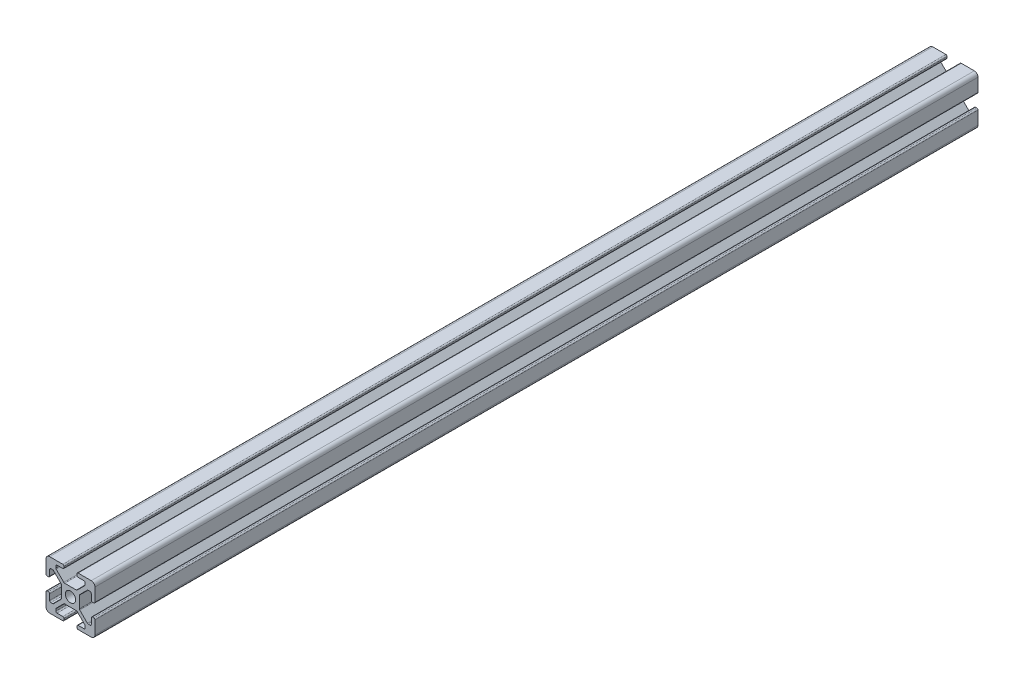
from build123d import *

# Parameters (mm, degrees)
SKETCH1_W               = 20
SKETCH1_H               = 20
BOSS_EXTRUDE1_DEPTH     = 361
CUT_EXTRUDE1_DEPTH      = 362.276902112
FILLET1_R               = 0.5
CIRPATTERN1_START       = -361
CIRPATTERN1_DEPTH       = 361
FILLET2_R               = 1.5
SKETCH3_R               = 2.095
CUT_EXTRUDE2_DEPTH      = 362.276902112
FILLET3_R               = 0.5
CUT_EXTRUDE3_DEPTH      = 362.396539863
CUT_EXTRUDE3_DEPTH_BACK = 362.396539863
SKETCH4_R               = 2.5


# Read off the part's stored shape, not the designer's step: CirPattern1
with BuildPart() as part:
    # Sketch1 → Boss-Extrude1 (new body)
    with BuildSketch(Plane.XY):
        Rectangle(SKETCH1_W, SKETCH1_H)
    extrude(amount=-BOSS_EXTRUDE1_DEPTH)

    # Sketch2 → Cut-Extrude1 (cut, through all)
    with BuildSketch(Plane.XY):
        Polygon((0, 10), (-2.63, 10), (-2.63, 8.5), (-5.995, 8.5), (-5.995, 7.055660172), (-2.594339828, 3.655), (2.594339828, 3.655), (5.995, 7.055660172), (5.995, 8.5), (2.63, 8.5), (2.63, 10), align=None)
    extrude(amount=-CUT_EXTRUDE1_DEPTH, mode=Mode.SUBTRACT)

    # Fillet1
    fillet1_edges = [part.edges().sort_by_distance(p)[0] for p in [
        (2.63, 10, -180.5),
        (2.63, 8.5, -180.5),
        (5.995, 8.5, -180.5),
        (5.995, 7.055660172, -180.5),
        (2.594339828, 3.655, -180.5),
        (-2.594339828, 3.655, -180.5),
        (-5.995, 7.055660172, -180.5),
        (-5.995, 8.5, -180.5),
        (-2.63, 8.5, -180.5),
        (-2.63, 10, -180.5),
    ]]
    fillet(fillet1_edges, radius=FILLET1_R)

    # CirPattern1 outline → CirPattern1 (cut)
    with BuildSketch(Plane.XY.offset(CIRPATTERN1_START)):
        with BuildLine():
            Line((-2.63, -10), (2.63, -10))
            Line((2.63, -10), (2.63, -9))
            ThreePointArc((2.63, -9), (2.776446609, -8.646446609), (3.13, -8.5))
            Line((3.13, -8.5), (5.495, -8.5))
            ThreePointArc((5.495, -8.5), (5.848553391, -8.353553391), (5.995, -8))
            Line((5.995, -8), (5.995, -7.262766953))
            ThreePointArc((5.995, -7.262766953), (5.956939766, -7.071425237), (5.848553391, -6.909213562))
            Line((5.848553391, -6.909213562), (2.740786438, -3.801446609))
            ThreePointArc((2.740786438, -3.801446609), (2.578574763, -3.693060234), (2.387233047, -3.655))
            Line((2.387233047, -3.655), (-2.387233047, -3.655))
            ThreePointArc((-2.387233047, -3.655), (-2.578574763, -3.693060234), (-2.740786438, -3.801446609))
            Line((-2.740786438, -3.801446609), (-5.848553391, -6.909213562))
            ThreePointArc((-5.848553391, -6.909213562), (-5.956939766, -7.071425237), (-5.995, -7.262766953))
            Line((-5.995, -7.262766953), (-5.995, -8))
            ThreePointArc((-5.995, -8), (-5.848553391, -8.353553391), (-5.495, -8.5))
            Line((-5.495, -8.5), (-3.13, -8.5))
            ThreePointArc((-3.13, -8.5), (-2.776446609, -8.646446609), (-2.63, -9))
            Line((-2.63, -9), (-2.63, -10))
        make_face()
        with BuildLine():
            Line((-10, 2.63), (-10, -2.63))
            Line((-10, -2.63), (-9, -2.63))
            ThreePointArc((-9, -2.63), (-8.646446609, -2.776446609), (-8.5, -3.13))
            Line((-8.5, -3.13), (-8.5, -5.495))
            ThreePointArc((-8.5, -5.495), (-8.353553391, -5.848553391), (-8, -5.995))
            Line((-8, -5.995), (-7.262766953, -5.995))
            ThreePointArc((-7.262766953, -5.995), (-7.071425237, -5.956939766), (-6.909213562, -5.848553391))
            Line((-6.909213562, -5.848553391), (-3.801446609, -2.740786438))
            ThreePointArc((-3.801446609, -2.740786438), (-3.693060234, -2.578574763), (-3.655, -2.387233047))
            Line((-3.655, -2.387233047), (-3.655, 2.387233047))
            ThreePointArc((-3.655, 2.387233047), (-3.693060234, 2.578574763), (-3.801446609, 2.740786438))
            Line((-3.801446609, 2.740786438), (-6.909213562, 5.848553391))
            ThreePointArc((-6.909213562, 5.848553391), (-7.071425237, 5.956939766), (-7.262766953, 5.995))
            Line((-7.262766953, 5.995), (-8, 5.995))
            ThreePointArc((-8, 5.995), (-8.353553391, 5.848553391), (-8.5, 5.495))
            Line((-8.5, 5.495), (-8.5, 3.13))
            ThreePointArc((-8.5, 3.13), (-8.646446609, 2.776446609), (-9, 2.63))
            Line((-9, 2.63), (-10, 2.63))
        make_face()
        with BuildLine():
            Line((9, -2.63), (10, -2.63))
            Line((10, -2.63), (10, 2.63))
            Line((10, 2.63), (9, 2.63))
            ThreePointArc((9, 2.63), (8.646446609, 2.776446609), (8.5, 3.13))
            Line((8.5, 3.13), (8.5, 5.495))
            ThreePointArc((8.5, 5.495), (8.353553391, 5.848553391), (8, 5.995))
            Line((8, 5.995), (7.262766953, 5.995))
            ThreePointArc((7.262766953, 5.995), (7.071425237, 5.956939766), (6.909213562, 5.848553391))
            Line((6.909213562, 5.848553391), (3.801446609, 2.740786438))
            ThreePointArc((3.801446609, 2.740786438), (3.693060234, 2.578574763), (3.655, 2.387233047))
            Line((3.655, 2.387233047), (3.655, -2.387233047))
            ThreePointArc((3.655, -2.387233047), (3.693060234, -2.578574763), (3.801446609, -2.740786438))
            Line((3.801446609, -2.740786438), (6.909213562, -5.848553391))
            ThreePointArc((6.909213562, -5.848553391), (7.071425237, -5.956939766), (7.262766953, -5.995))
            Line((7.262766953, -5.995), (8, -5.995))
            ThreePointArc((8, -5.995), (8.353553391, -5.848553391), (8.5, -5.495))
            Line((8.5, -5.495), (8.5, -3.13))
            ThreePointArc((8.5, -3.13), (8.646446609, -2.776446609), (9, -2.63))
        make_face()
    extrude(amount=CIRPATTERN1_DEPTH, mode=Mode.SUBTRACT)

    # Fillet2
    fillet2_edges = [part.edges().sort_by_distance(p)[0] for p in [
        (10, -10, -180.5),
        (-10, -10, -180.5),
        (-10, 10, -180.5),
        (10, 10, -180.5),
    ]]
    fillet(fillet2_edges, radius=FILLET2_R)

    # Sketch3 → Cut-Extrude2 (cut, through all)
    with BuildSketch(Plane.XY):
        Circle(SKETCH3_R)
    extrude(amount=-CUT_EXTRUDE2_DEPTH, mode=Mode.SUBTRACT)

    # Fillet3
    fillet3_edges = [part.edges().sort_by_distance(p)[0] for p in [
        (-10, 2.63, -180.5),
        (-10, -2.63, -180.5),
        (-2.63, -10, -180.5),
        (2.63, -10, -180.5),
        (10, -2.63, -180.5),
        (10, 2.63, -180.5),
    ]]
    fillet(fillet3_edges, radius=FILLET3_R)

    # Sketch4 → Cut-Extrude3 (cut, two sides: drawn at the far end of the back side and taken through both)
    with BuildSketch(Plane.ZY.offset(3.655).offset(-CUT_EXTRUDE3_DEPTH_BACK)):
        with Locations(Location((-180.5, 0, 0), (0, 0, 287.274468256))):
            Circle(SKETCH4_R)
    extrude(amount=CUT_EXTRUDE3_DEPTH + CUT_EXTRUDE3_DEPTH_BACK, mode=Mode.SUBTRACT)


solid = part.part
